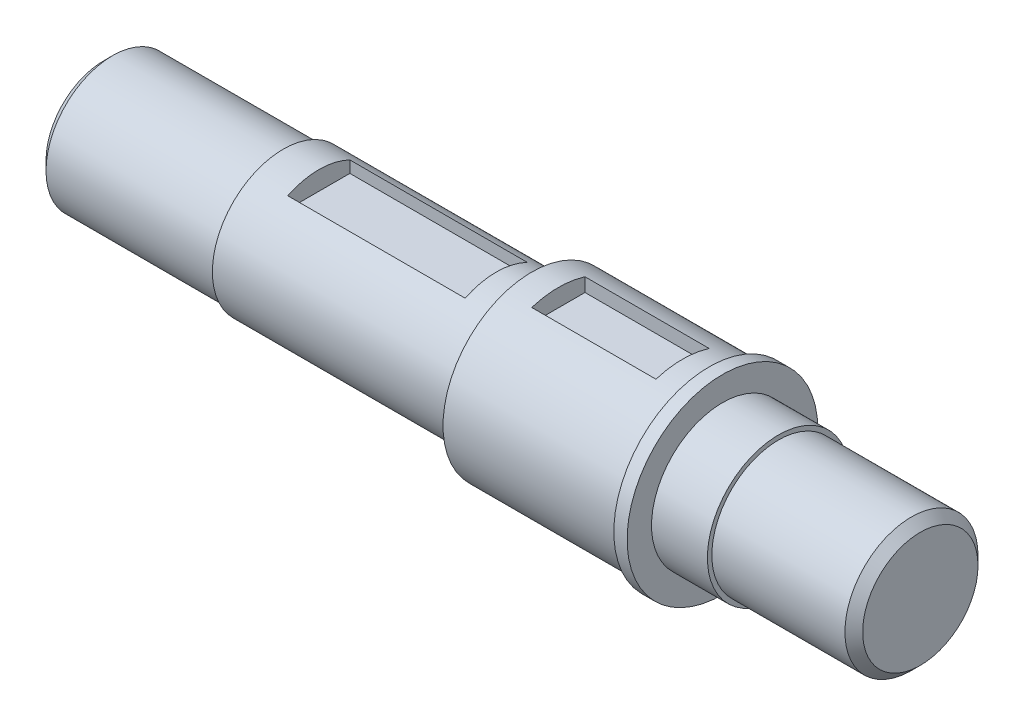
from build123d import *

# Parameters (mm, degrees)
CHAMFER_1_SIZE      = 2
CUT_EXTRUDE_START   = 11.75
SKETCH_3_W          = 40
SKETCH_3_H          = 14
CUT_EXTRUDE_1_DEPTH = 25
CUT_EXTRUDE_START_2 = 16
SKETCH_4_W          = 28
SKETCH_4_H          = 12
CUT_EXTRUDE_2_DEPTH = 11


with BuildPart() as part:
    # 草图2 → 旋转1 (revolve)
    with BuildSketch(Plane(origin=(0, 0, 0), x_dir=(1, 0, 0), z_dir=(0, 1, 0))):
        Polygon((0, 0), (0, 15), (40.5, 15), (40.5, 16), (96.5, 16), (96.5, 20), (136.5, 20), (136.5, 21.5), (139.5, 21.5), (139.5, 16), (152.1, 16), (152.1, 15), (184.1, 15), (184.1, 0), align=None)
    revolve(axis=Axis((184.1, 0, 0), (-1, 0, 0)))

    # 倒角1
    chamfer_1_edges = [part.edges().sort_by_distance(p)[0] for p in [
        (184.1, 0, 15),
        (0, 0, 15),
    ]]
    chamfer(chamfer_1_edges, length=CHAMFER_1_SIZE)

    # 草图3 → 切除-拉伸1 (cut)
    with BuildSketch(Plane(origin=(0, 0, 0), x_dir=(1, 0, 0), z_dir=(0, 1, 0)).offset(CUT_EXTRUDE_START)):
        with Locations((68.5, 0)):
            Rectangle(SKETCH_3_W, SKETCH_3_H)
    extrude(amount=CUT_EXTRUDE_1_DEPTH, mode=Mode.SUBTRACT)

    # 草图4 → 切除-拉伸2 (cut)
    with BuildSketch(Plane(origin=(0, 0, 0), x_dir=(1, 0, 0), z_dir=(0, 1, 0)).offset(CUT_EXTRUDE_START_2)):
        with Locations((116.5, 0)):
            Rectangle(SKETCH_4_W, SKETCH_4_H)
    extrude(amount=CUT_EXTRUDE_2_DEPTH, mode=Mode.SUBTRACT)


solid = part.part
